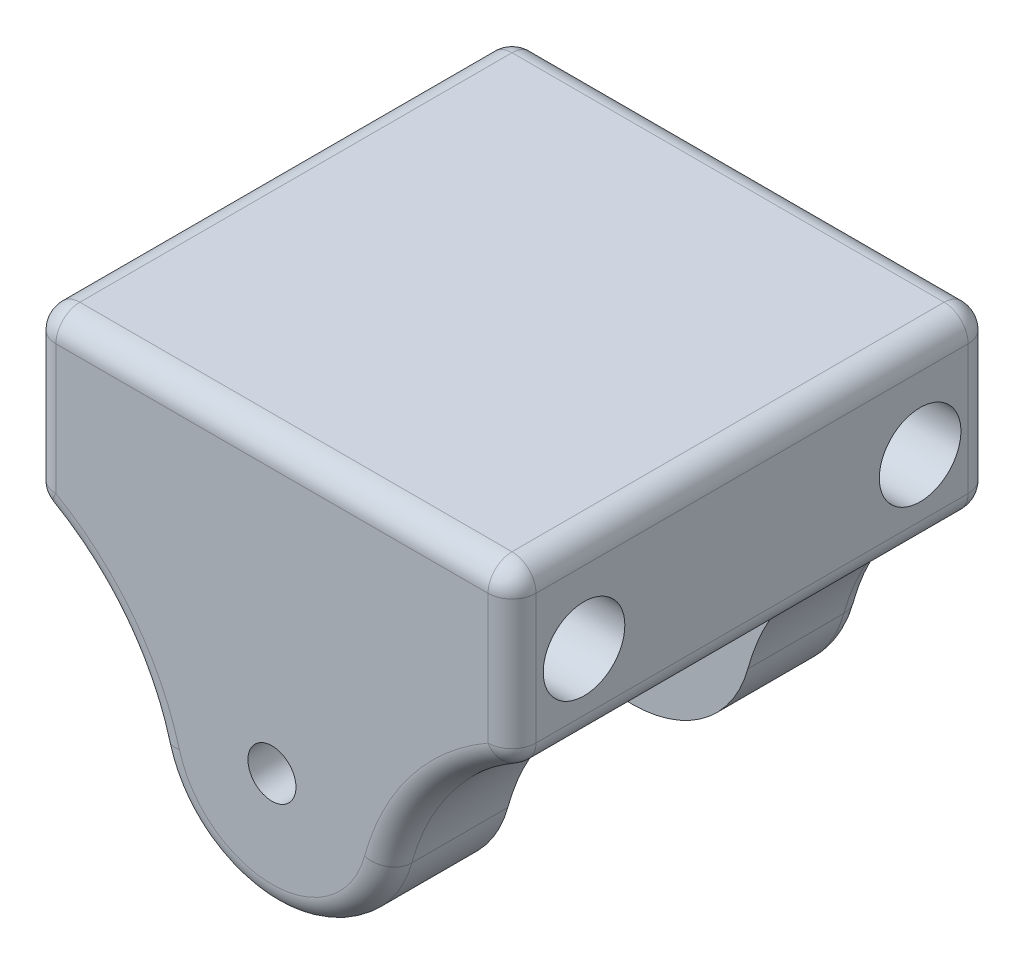
from build123d import *

# Parameters (mm, degrees)
SKETCH1_R           = 1
BOSS_EXTRUDE1_DEPTH = 20
SKETCH2_R           = 1.7
CUT_EXTRUDE1_DEPTH  = 33.496153619
SKETCH3_W           = 20
SKETCH3_H           = 4
CUT_EXTRUDE2_DEPTH  = 33.496153619
CUT_EXTRUDE3_DEPTH  = 28.730849248
FILLET1_DEPTH       = 20
FILLET1_2_DEPTH     = 5
FILLET1_START       = 15
FILLET1_3_DEPTH     = 5
FILLET2_R           = 1


with BuildPart() as part:
    # Sketch1 → Boss-Extrude1 (new body)
    with BuildSketch(Plane.XY):
        with BuildLine():
            Line((5, 0), (5, 5))
            Line((5, 5), (10, 5))
            Line((10, 5), (10, 16))
            Line((10, 16), (-10, 16))
            Line((-10, 16), (-10, 5))
            Line((-10, 5), (-5, 5))
            Line((-5, 5), (-5, 0))
            ThreePointArc((-5, 0), (0, -5), (5, 0))
        make_face()
        Circle(SKETCH1_R, mode=Mode.SUBTRACT)
    extrude(amount=BOSS_EXTRUDE1_DEPTH)

    # Sketch2 → Cut-Extrude1 (cut, through all)
    with BuildSketch(Plane(origin=(10, 0, 0), x_dir=(0, 0, -1), z_dir=(1, 0, 0))):
        with Locations((-17, 8)):
            Circle(SKETCH2_R)
        with Locations(Location((-3, 8, 0), (0, 0, 180))):
            Circle(SKETCH2_R)
    extrude(amount=-CUT_EXTRUDE1_DEPTH, mode=Mode.SUBTRACT)

    # Sketch3 → Cut-Extrude2 (cut, through all)
    with BuildSketch(Plane(origin=(10, 0, 0), x_dir=(0, 0, -1), z_dir=(1, 0, 0))):
        with Locations((-10, 14)):
            Rectangle(SKETCH3_W, SKETCH3_H)
    extrude(amount=-CUT_EXTRUDE2_DEPTH, mode=Mode.SUBTRACT)

    # Sketch4 → Cut-Extrude3 (cut, through all)
    with BuildSketch(Plane(origin=(5, 0, 0), x_dir=(0, 0, -1), z_dir=(1, 0, 0))):
        Polygon((-10, -5), (-15, -5), (-15, 2), (-5, 2), (-5, -5), align=None)
    extrude(amount=-CUT_EXTRUDE3_DEPTH, mode=Mode.SUBTRACT)

    # Fillet1: read off the stored shape, not the designer's step
    # Fillet1 outline → Fillet1 (add)
    with BuildSketch(Plane.XY):
        with BuildLine():
            Line((5, 2), (6.4306416, 2))
            ThreePointArc((6.4306416, 2), (8.038028722, 3.710939656), (10, 5))
            Line((10, 5), (5, 5))
            Line((5, 5), (5, 2))
        make_face()
        with BuildLine():
            Line((-6.4306416, 2), (-5, 2))
            Line((-5, 2), (-5, 5))
            Line((-5, 5), (-10, 5))
            ThreePointArc((-10, 5), (-8.038028722, 3.710939656), (-6.4306416, 2))
        make_face()
    extrude(amount=FILLET1_DEPTH)

    # Fillet1 2 outline → Fillet1 2 (add)
    with BuildSketch(Plane.XY):
        with BuildLine():
            ThreePointArc((4.824045318, -1.314757303), (5.473399472, 0.417234907), (6.4306416, 2))
            Line((6.4306416, 2), (5, 2))
            Line((5, 2), (5, 0))
            ThreePointArc((5, 0), (4.955816204, -0.663238839), (4.824045318, -1.314757303))
        make_face()
        with BuildLine():
            Line((-5, 0), (-5, 2))
            Line((-5, 2), (-6.4306416, 2))
            ThreePointArc((-6.4306416, 2), (-5.473399472, 0.417234907), (-4.824045318, -1.314757303))
            ThreePointArc((-4.824045318, -1.314757303), (-4.955816204, -0.663238839), (-5, 0))
        make_face()
    extrude(amount=FILLET1_2_DEPTH)

    # Fillet1 3 outline → Fillet1 3 (add)
    with BuildSketch(Plane.XY.offset(FILLET1_START)):
        with BuildLine():
            ThreePointArc((4.824045318, -1.314757303), (5.473399472, 0.417234907), (6.4306416, 2))
            Line((6.4306416, 2), (5, 2))
            Line((5, 2), (5, 0))
            ThreePointArc((5, 0), (4.955816204, -0.663238839), (4.824045318, -1.314757303))
        make_face()
        with BuildLine():
            Line((-5, 0), (-5, 2))
            Line((-5, 2), (-6.4306416, 2))
            ThreePointArc((-6.4306416, 2), (-5.473399472, 0.417234907), (-4.824045318, -1.314757303))
            ThreePointArc((-4.824045318, -1.314757303), (-4.955816204, -0.663238839), (-5, 0))
        make_face()
    extrude(amount=FILLET1_3_DEPTH)

    # Fillet2
    fillet2_edges = [part.edges().sort_by_distance(p)[0] for p in [
        (10, 8.5, 0),
        (-10, 5, 10),
        (10, 5, 10),
        (10, 8.5, 20),
        (-10, 8.5, 0),
        (-10, 8.5, 20),
        (-10, 12, 10),
        (0, 12, 0),
        (0, 12, 20),
        (10, 12, 10),
        (0, -5, 0),
        (0, -5, 20),
        (8.038028722, 3.710939656, 0),
        (8.038028722, 3.710939656, 20),
        (-8.038028722, 3.710939656, 0),
        (-8.038028722, 3.710939656, 20),
    ]]
    fillet(fillet2_edges, radius=FILLET2_R)


solid = part.part
